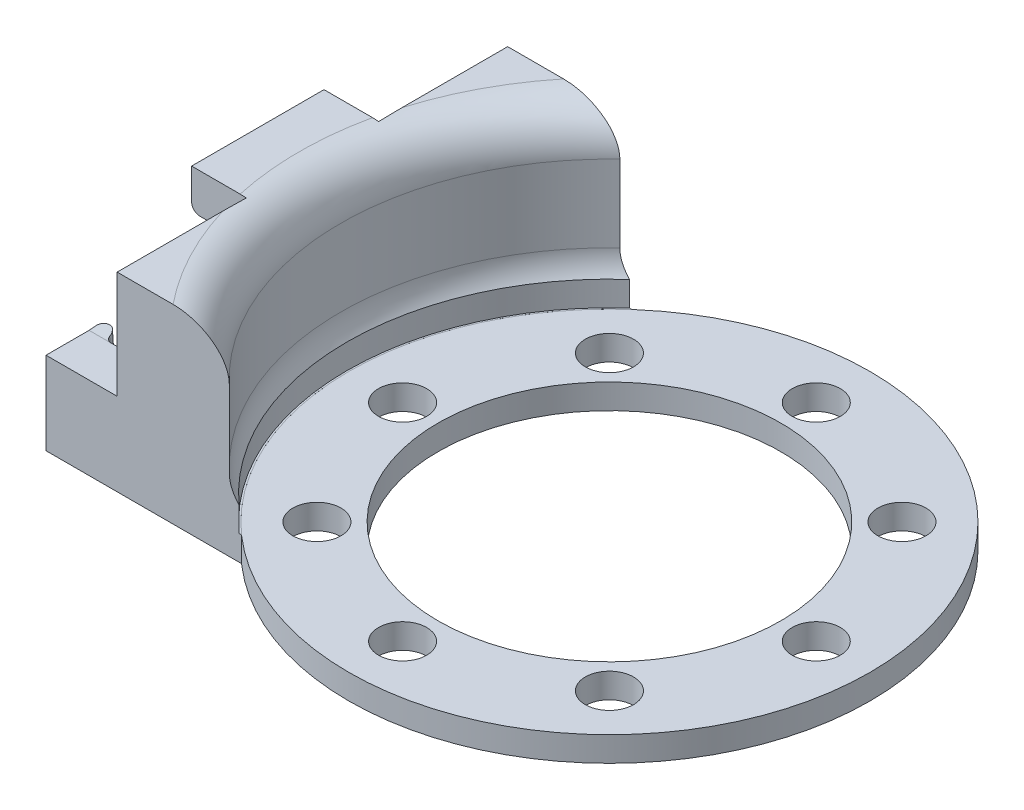
from build123d import *

# Parameters (mm, degrees)
SKETCH_1_R          = 31.5
SKETCH_1_R_2        = 20.714023716
SKETCH_1_R_3        = 2.909798399
EXTRUDE_1_DEPTH     = 3
EXTRUDE_2_DEPTH     = 23
CUT_EXTRUDE_1_DEPTH = 8.6
SKETCH_5_R          = 32.5
CUT_EXTRUDE_2_DEPTH = 17
FILLET_1_R          = 5
FILLET_2_R          = 1.8
FILLET_4_R          = 0.8
FILLET_5_R          = 0.8
SKETCH_8_W          = 38.793065546
SKETCH_8_H          = 19.973810534
CUT_EXTRUDE_3_DEPTH = 2
FILLET_6_R          = 1
SKETCH_9_R          = 31.7
CUT_EXTRUDE_4_DEPTH = 3
FILLET_7_R          = 5


with BuildPart() as part:
    # 草图1 → 凸台-拉伸1 (new body)
    with BuildSketch(Plane(origin=(0, 0, 0), x_dir=(1, 0, 0), z_dir=(0, 1, 0))):
        with Locations(Location((0, 0, 0), (0, 0, 270))):
            Circle(SKETCH_1_R)
        with Locations(Location((0, 0, 0), (0, 0, 270))):
            Circle(SKETCH_1_R_2, mode=Mode.SUBTRACT)
        with Locations(Location((0, -25, 0), (0, 0, 270))):
            Circle(SKETCH_1_R_3, mode=Mode.SUBTRACT)
        with Locations(Location((-17.67766953, -17.67766953, 0), (0, 0, 270))):
            Circle(SKETCH_1_R_3, mode=Mode.SUBTRACT)
        with Locations(Location((-25, 0, 0), (0, 0, 270))):
            Circle(SKETCH_1_R_3, mode=Mode.SUBTRACT)
        with Locations(Location((-17.67766953, 17.67766953, 0), (0, 0, 270))):
            Circle(SKETCH_1_R_3, mode=Mode.SUBTRACT)
        with Locations(Location((0, 25, 0), (0, 0, 270))):
            Circle(SKETCH_1_R_3, mode=Mode.SUBTRACT)
        with Locations(Location((17.67766953, 17.67766953, 0), (0, 0, 270))):
            Circle(SKETCH_1_R_3, mode=Mode.SUBTRACT)
        with Locations(Location((25, 0, 0), (0, 0, 270))):
            Circle(SKETCH_1_R_3, mode=Mode.SUBTRACT)
        with Locations(Location((17.67766953, -17.67766953, 0), (0, 0, 270))):
            Circle(SKETCH_1_R_3, mode=Mode.SUBTRACT)
    extrude(amount=EXTRUDE_1_DEPTH)


with BuildPart() as body_2:
    # 草图2 → 凸台-拉伸2 (new body)
    with BuildSketch(Plane(origin=(0, 0, 0), x_dir=(1, 0, 0), z_dir=(0, 1, 0))):
        with BuildLine():
            Line((-44.5, 23.6), (-44.5, -23.6))
            Line((-44.5, -23.6), (-20.863604674, -23.6))
            ThreePointArc((-20.863604674, -23.6), (-31.5, 0), (-20.863604674, 23.6))
            Line((-20.863604674, 23.6), (-44.5, 23.6))
        make_face()
    extrude(amount=EXTRUDE_2_DEPTH)

    # 草图3 → 切除-拉伸1 (cut)
    with BuildSketch(Plane.ZY.offset(44.5)):
        with BuildLine():
            Line((-8, 18.251227904), (-8, 23))
            Line((-8, 23), (-23.6, 23))
            Line((-23.6, 23), (-23.6, 10))
            Line((-23.6, 10), (-18.392761811, 10))
            ThreePointArc((-18.392761811, 10), (-18.098228291, 5.00385506), (-18, 0))
            Line((-18, 0), (18, 0))
            ThreePointArc((18, 0), (18.098228291, 5.00385506), (18.392761811, 10))
            Line((18.392761811, 10), (23.6, 10))
            Line((23.6, 10), (23.6, 23))
            Line((23.6, 23), (8, 23))
            Line((8, 23), (8, 18.251227904))
            ThreePointArc((8, 18.251227904), (0, 18), (-8, 18.251227904))
        make_face()
    extrude(amount=-CUT_EXTRUDE_1_DEPTH, mode=Mode.SUBTRACT)

    # 草图5 → 切除-拉伸2 (cut)
    with BuildSketch(Plane(origin=(0, 23, 0), x_dir=(1, 0, 0), z_dir=(0, 1, 0))):
        Circle(SKETCH_5_R)
    extrude(amount=-CUT_EXTRUDE_2_DEPTH, mode=Mode.SUBTRACT)

    # 圆角1
    # the kernel refuses this fillet: 5 mm, written as the material it takes off along each edge
    with BuildSketch(Plane(origin=(0, 23, 0), x_dir=(-0.3646941876618019, 0, -0.9311273540637169), z_dir=(0.9311273540637169, 0, -0.3646941876618019))) as fillet_1_piece_1:
        with BuildLine():
            CenterArc((32.5 + FILLET_1_R, -FILLET_1_R), FILLET_1_R, 90, 90)
            Line((32.5, -FILLET_1_R), (32.5, 0))
            Line((32.5, 0), (32.5 + FILLET_1_R, 0))
        make_face()
    revolve(axis=Axis((0, 23, 0), (0, 1, 0)), revolution_arc=137.222472588, mode=Mode.SUBTRACT)

    # 圆角2
    fillet_2_edges = [body_2.edges().sort_by_distance(p)[0] for p in [
        (-35.9, 5.00385506, 18.098228291),
        (-35.9, 5.00385506, -18.098228291),
        (-35.9, 18, 0),
    ]]
    fillet(fillet_2_edges, radius=FILLET_2_R)

    # 扫描1: sweep along a curve in space
    with BuildLine() as sweep_1_path:
        ThreePointArc((-44.5, 0, 18), (-44.5, 5.00385506, 18.098228291), (-44.5, 10, 18.392761811))
    # 草图6 → 扫描1 (sweep)
    with BuildSketch(Plane(origin=(0, 0, 0), x_dir=(1, 0, 0), z_dir=(0, 1, 0))):
        with BuildLine():
            Line((-44.5, -18), (-44.5, -16))
            ThreePointArc((-44.5, -16), (-43.085786438, -16.585786438), (-42.5, -18))
            Line((-42.5, -18), (-44.5, -18))
        make_face()
    sweep(path=sweep_1_path.line)

    # 扫描2: sweep along a curve in space
    with BuildLine() as sweep_2_path:
        ThreePointArc((-44.5, 0, -18), (-44.5, 5.00385506, -18.098228291), (-44.5, 10, -18.392761811))
    # 草图7 → 扫描2 (sweep)
    with BuildSketch(Plane(origin=(0, 0, 0), x_dir=(1, 0, 0), z_dir=(0, 1, 0))):
        with BuildLine():
            Line((-44.5, 18), (-44.5, 16))
            ThreePointArc((-44.5, 16), (-43.085786438, 16.585786438), (-42.5, 18))
            Line((-42.5, 18), (-44.5, 18))
        make_face()
    sweep(path=sweep_2_path.line)

    # 圆角4
    fillet_4_edges = [body_2.edges().sort_by_distance(p)[0] for p in [
        (-44.5, 5.082346904, 16.099769127),
        (-42.5, 5.00385506, -18.098228291),
        (-44.5, 5.082346904, -16.099769127),
    ]]
    fillet(fillet_4_edges, radius=FILLET_4_R)

    # 圆角5
    fillet_5_edges = [body_2.edges().sort_by_distance(p)[0] for p in [
        (-42.5, 5.00385506, 18.098228291),
    ]]
    fillet(fillet_5_edges, radius=FILLET_5_R)

    # 草图8 → 切除-拉伸3 (cut)
    with BuildSketch(Plane.ZY.offset(44.5)):
        with Locations((-8.315025409, 25.620375372)):
            Rectangle(SKETCH_8_W, SKETCH_8_H)
    extrude(amount=-CUT_EXTRUDE_3_DEPTH, mode=Mode.SUBTRACT)

    # 圆角6
    fillet_6_edges = [body_2.edges().sort_by_distance(p)[0] for p in [
        (-42.5, 18, 0),
    ]]
    fillet(fillet_6_edges, radius=FILLET_6_R)

    # 草图9 → 切除-拉伸4 (cut)
    with BuildSketch(Plane(origin=(0, 6, 0), x_dir=(1, 0, 0), z_dir=(0, 1, 0))):
        Circle(SKETCH_9_R)
    extrude(amount=-CUT_EXTRUDE_4_DEPTH, mode=Mode.SUBTRACT)

    # 圆角7
    # the kernel refuses this fillet: 5 mm, written as the material it adds along each edge
    with BuildSketch(Plane(origin=(0, 6, 0), x_dir=(-0.5220974400053939, 0, -0.8528858441431738), z_dir=(0.8528858441431738, 0, -0.5220974400053939))) as fillet_7_piece_1_section:
        with BuildLine():
            CenterArc((27.5, 2.712931993), FILLET_7_R, 327.140119621, 32.859880379)
            Line((31.7, 0), (31.784, -0.05425864))
            ThreePointArc((31.784, -0.05425864), (32.1, -0.1), (32.5, -0.1))
            Line((32.5, -0.1), (32.6, 0))
            Line((32.6, 0), (32.6, 2.712931993))
            Line((32.6, 2.712931993), (32.5, 2.712931993))
        make_face()
    fillet_7_piece_1 = revolve(axis=Axis((0, 6, 0), (0, 1, 0)), revolution_arc=117.053901852, mode=Mode.PRIVATE)
    fillet_7_piece_1 = split(fillet_7_piece_1, bisect_by=Plane(origin=(-32.332369632, 7.28794393, 23.6), z_dir=(0, 0, -1)), keep=Keep.TOP, mode=Mode.PRIVATE)
    fillet_7_piece_1 = split(fillet_7_piece_1, bisect_by=Plane(origin=(-32.332369632, 7.28794393, -23.6), z_dir=(0, 0, 1)), keep=Keep.TOP, mode=Mode.PRIVATE)
    add(fillet_7_piece_1)


solid = Compound([part.part, body_2.part])
